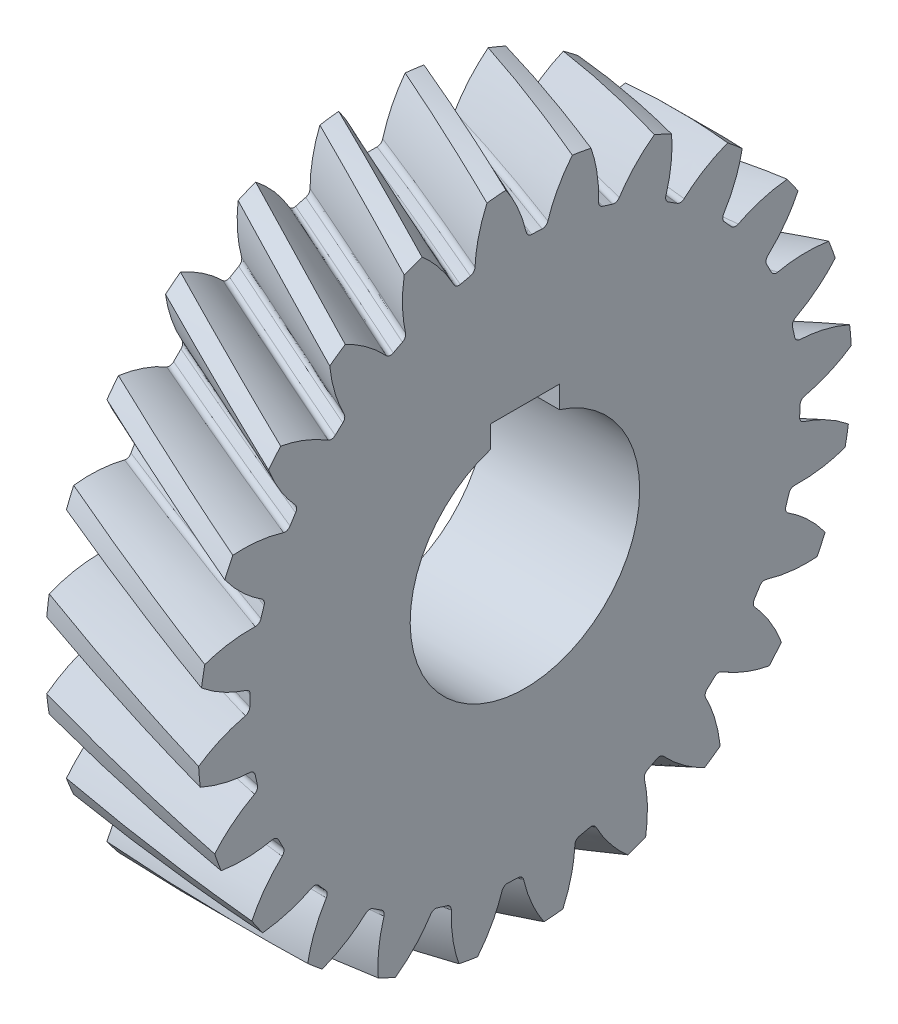
from build123d import *

# Parameters (mm, degrees)
BASPROSKE_W            = 40
BASPROSKE_H            = 85.443210165
TOOTHCUTRH_PITCH       = 1151.290383763
TOOTHCUTRH_HEIGHT      = 40
TOOTHCUTRH_RADIUS      = 85.443210165
TOOTHCUTRH_START_ANGLE = -90
TEETHCUTSRH_COUNT      = 24
TEETHCUTSRH_ANGLE      = 345
BORSKE_R               = 30
BORE_DEPTH             = 62.5000025
KEYSKE_W               = 18
KEYSKE_H               = 34.4
KEYWAY_DEPTH           = 62.5000025


with BuildPart() as part:
    # BasProSke → Base-Revolve (revolve)
    with BuildSketch(Plane(origin=(0, 0, 0), x_dir=(1, 0, 0), z_dir=(0, 1, 0)), mode=Mode.PRIVATE) as base_revolve_sk:
        with Locations((20, 42.721605083)):
            Rectangle(BASPROSKE_W, BASPROSKE_H)
    revolve(base_revolve_sk.sketch.rotate(Axis((-10, 0, 0), (1, 0, 0)), 180), axis=Axis((-10, 0, 0), (1, 0, 0)))

    # ToothCutRH: sweep along a helix
    with BuildLine() as toothcutrh_path:
        add(Helix(TOOTHCUTRH_PITCH, TOOTHCUTRH_HEIGHT, TOOTHCUTRH_RADIUS, center=(0, 0, 0), direction=(1, 0, 0), mode=Mode.PRIVATE).rotate(Axis((0, 0, 0), (1, 0, 0)), TOOTHCUTRH_START_ANGLE))
    # TooCutSkeRH → ToothCutRH (sweep, cut)
    with BuildSketch(Plane(origin=(0, 0, 0), x_dir=(0, 0, -1), z_dir=(1, 0, 0))):
        with BuildLine():
            ThreePointArc((1.352254293, 71.930500465), (0, 71.943210165), (-1.352254293, 71.930500465))
            ThreePointArc((-1.352254293, 71.930500465), (-2.278463024, 72.228486498), (-2.827354965, 73.031839425))
            ThreePointArc((-2.827354965, 73.031839425), (-5.899912255, 80.644805336), (-10.617352348, 87.363705337))
            ThreePointArc((-10.617352348, 87.363705337), (0, 88.00650647), (10.617352348, 87.363705337))
            ThreePointArc((10.617352348, 87.363705337), (5.899912255, 80.644805336), (2.827354965, 73.031839425))
            ThreePointArc((2.827354965, 73.031839425), (2.278463024, 72.228486498), (1.352254293, 71.930500465))
        make_face()
    toothcutrh = sweep(path=toothcutrh_path.line, is_frenet=True, mode=Mode.SUBTRACT)

    # TeethCutsRH: ToothCutRH ×24 about axis
    teethcutsrh_axis = Axis((-10, 0, 0), (1, 0, 0))
    for i in range(1, TEETHCUTSRH_COUNT):
        add(toothcutrh.rotate(teethcutsrh_axis, i * TEETHCUTSRH_ANGLE / (TEETHCUTSRH_COUNT - 1)), mode=Mode.SUBTRACT)

    # BorSke → Bore (cut, symmetric)
    with BuildSketch(Plane(origin=(0, 0, 0), x_dir=(0, 0, -1), z_dir=(1, 0, 0))):
        with Locations(Location((0, 0, 0), (0, 0, 180))):
            Circle(BORSKE_R)
    extrude(amount=BORE_DEPTH, both=True, mode=Mode.SUBTRACT)

    # KeySke → Keyway (cut, symmetric)
    with BuildSketch(Plane(origin=(0, 0, 0), x_dir=(0, 0, -1), z_dir=(1, 0, 0))):
        with Locations((0, 17.2)):
            Rectangle(KEYSKE_W, KEYSKE_H)
    extrude(amount=KEYWAY_DEPTH, both=True, mode=Mode.SUBTRACT)


solid = part.part
